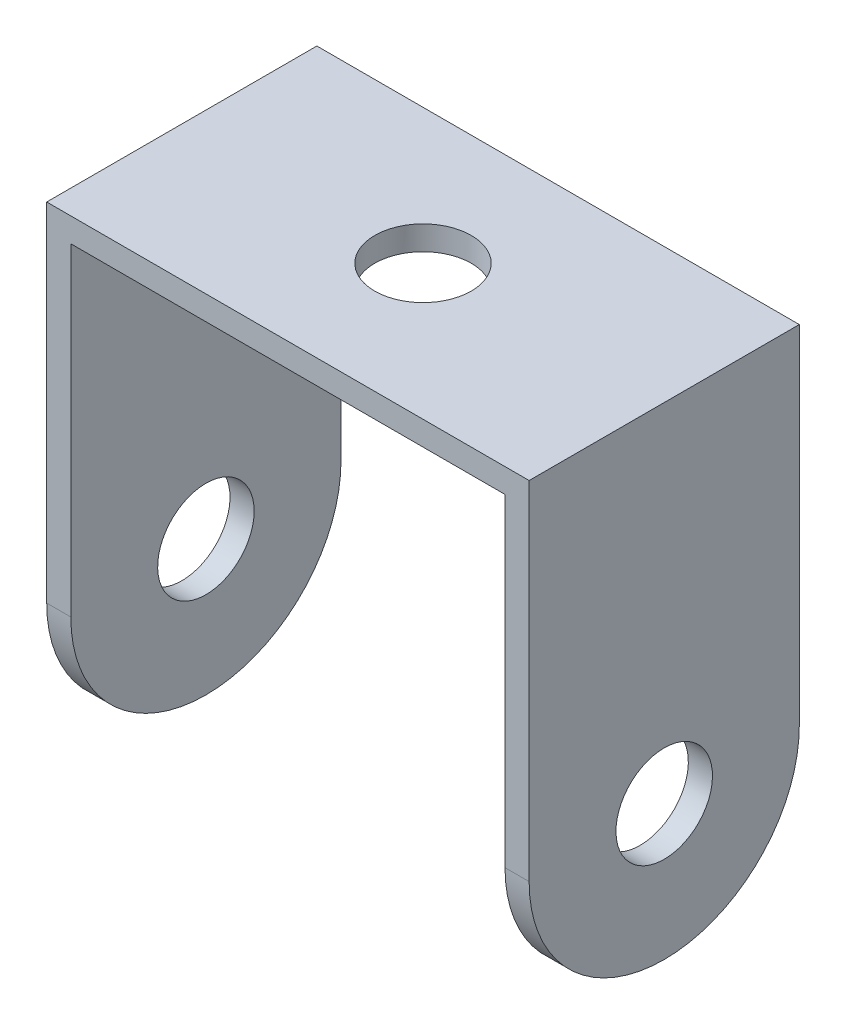
from build123d import *

# Parameters (mm, degrees)
ESBO_O1_W                = 50
ESBO_O1_H                = 50
RESSALTO_EXTRUS_O1_DEPTH = 28
ESBO_O2_W                = 45
ESBO_O2_H                = 47.5
CORTE_EXTRUS_O1_DEPTH    = 28
ESBO_O3_R                = 5
CORTE_EXTRUS_O2_DEPTH    = 63.521996129
ESBO_O4_R                = 5
CORTE_EXTRUS_O3_DEPTH    = 63.521996129
FILETE1_R                = 14


with BuildPart() as part:
    # Esboço1 → Ressalto-extrusão1 (new body)
    with BuildSketch(Plane.XY):
        Rectangle(ESBO_O1_W, ESBO_O1_H)
    extrude(amount=RESSALTO_EXTRUS_O1_DEPTH)

    # Esboço2 → Corte-extrusão1 (cut)
    with BuildSketch(Plane(origin=(0, 0, 0), x_dir=(-1, 0, 0), z_dir=(0, 0, -1))):
        with Locations((0, -1.25)):
            Rectangle(ESBO_O2_W, ESBO_O2_H)
    extrude(amount=-CORTE_EXTRUS_O1_DEPTH, mode=Mode.SUBTRACT)

    # Esboço3 → Corte-extrusão2 (cut, through all)
    with BuildSketch(Plane(origin=(0, 25, 0), x_dir=(1, 0, 0), z_dir=(0, 1, 0))):
        with Locations(Location((0, -14, 0), (0, 0, 270))):
            Circle(ESBO_O3_R)
    extrude(amount=-CORTE_EXTRUS_O2_DEPTH, mode=Mode.SUBTRACT)

    # Esboço4 → Corte-extrusão3 (cut, through all)
    with BuildSketch(Plane(origin=(25, 0, 0), x_dir=(0, 0, -1), z_dir=(1, 0, 0))):
        with Locations(Location((-14, -11, 0), (0, 0, 90))):
            Circle(ESBO_O4_R)
    extrude(amount=-CORTE_EXTRUS_O3_DEPTH, mode=Mode.SUBTRACT)

    # Filete1
    filete1_edges = [part.edges().sort_by_distance(p)[0] for p in [
        (23.75, -25, 28),
        (-23.75, -25, 28),
        (-23.75, -25, 0),
        (23.75, -25, 0),
    ]]
    fillet(filete1_edges, radius=FILETE1_R - 0.0001)  # a hair under: the kernel refuses the full size


solid = part.part
